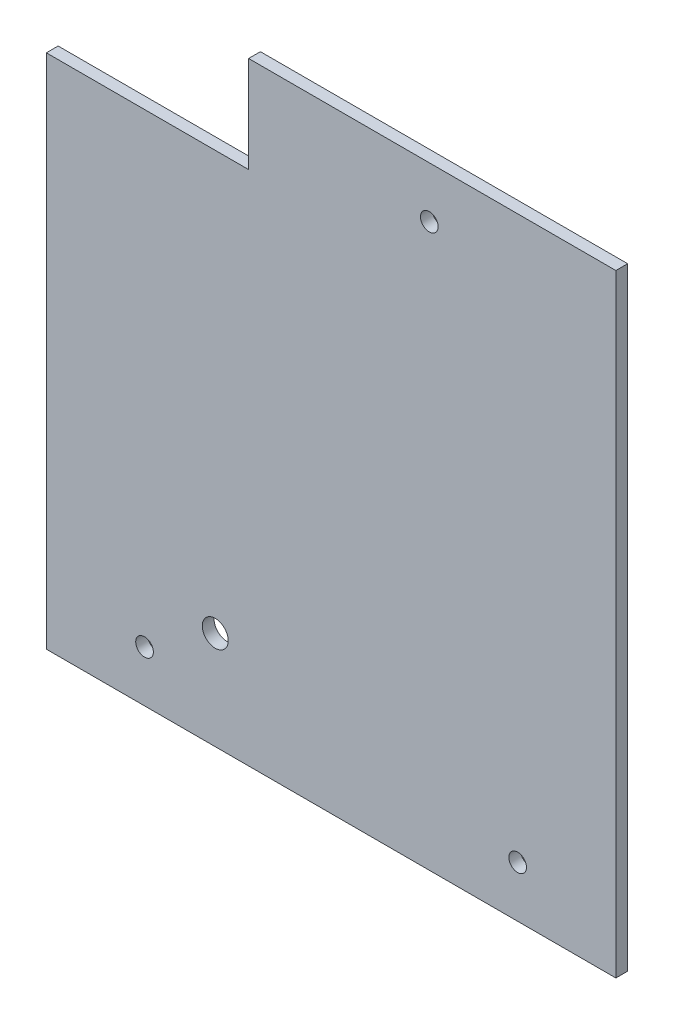
from build123d import *

# Parameters (mm, degrees)
SKIZZE1_W                       = 145
SKIZZE1_H                       = 156
AUFSATZ_LINEAR_AUSTRAGEN1_DEPTH = 3
DURCHGANGSLOCH_F_R_M41_D        = 4.5
DURCHGANGSLOCH_F_R_M41_DEPTH    = 3
DURCHGANGSLOCH_F_R_M41_TIP      = 1.351936393
SKIZZE5_W                       = 50
SKIZZE5_H                       = 23
SCHNITT_LINEAR_AUSTRAGEN1_DEPTH = 107.532858781
DURCHGANGSLOCH_F_R_M61_D        = 6.6
SCHNITT_LINEAR_AUSTRAGEN3_DEPTH = 107.532858781


with BuildPart() as part:
    # Skizze1 → Aufsatz-Linear austragen1 (new body)
    with BuildSketch(Plane.XY):
        Rectangle(SKIZZE1_W, SKIZZE1_H)
    extrude(amount=AUFSATZ_LINEAR_AUSTRAGEN1_DEPTH)

    # Durchgangsloch für M41
    with Locations(Plane.XY.offset(3)):
        with Locations((25, 65), (-47.5, -65), (47.5, -65)):
            Hole(DURCHGANGSLOCH_F_R_M41_D / 2, depth=DURCHGANGSLOCH_F_R_M41_DEPTH)
            with Locations((0, 0, -(DURCHGANGSLOCH_F_R_M41_DEPTH + DURCHGANGSLOCH_F_R_M41_TIP / 2))):  # 118° drill point
                Cone(0, DURCHGANGSLOCH_F_R_M41_D / 2, DURCHGANGSLOCH_F_R_M41_TIP, mode=Mode.SUBTRACT)

    # Skizze5 → Schnitt-Linear austragen1 (cut, through all)
    with BuildSketch(Plane(origin=(0, 0, 0), x_dir=(-1, 0, 0), z_dir=(0, 0, -1))):
        with Locations((47.5, 66.5)):
            Rectangle(SKIZZE5_W, SKIZZE5_H)
    extrude(amount=-SCHNITT_LINEAR_AUSTRAGEN1_DEPTH, mode=Mode.SUBTRACT)

    # Durchgangsloch für M61 (through all)
    with Locations(Plane.XY.offset(3)):
        with Locations((-29.5, -53)):
            Hole(DURCHGANGSLOCH_F_R_M61_D / 2)

    # Skizze9 → Schnitt-Linear austragen3 (cut, through all)
    with BuildSketch(Plane.XY.offset(3)):
        Polygon((-21, 78), (-21, 53.5), (-72.5, 53.5), (-72.5, 55), (-22.5, 55), (-22.5, 78), align=None)
    extrude(amount=-SCHNITT_LINEAR_AUSTRAGEN3_DEPTH, mode=Mode.SUBTRACT)


solid = part.part
